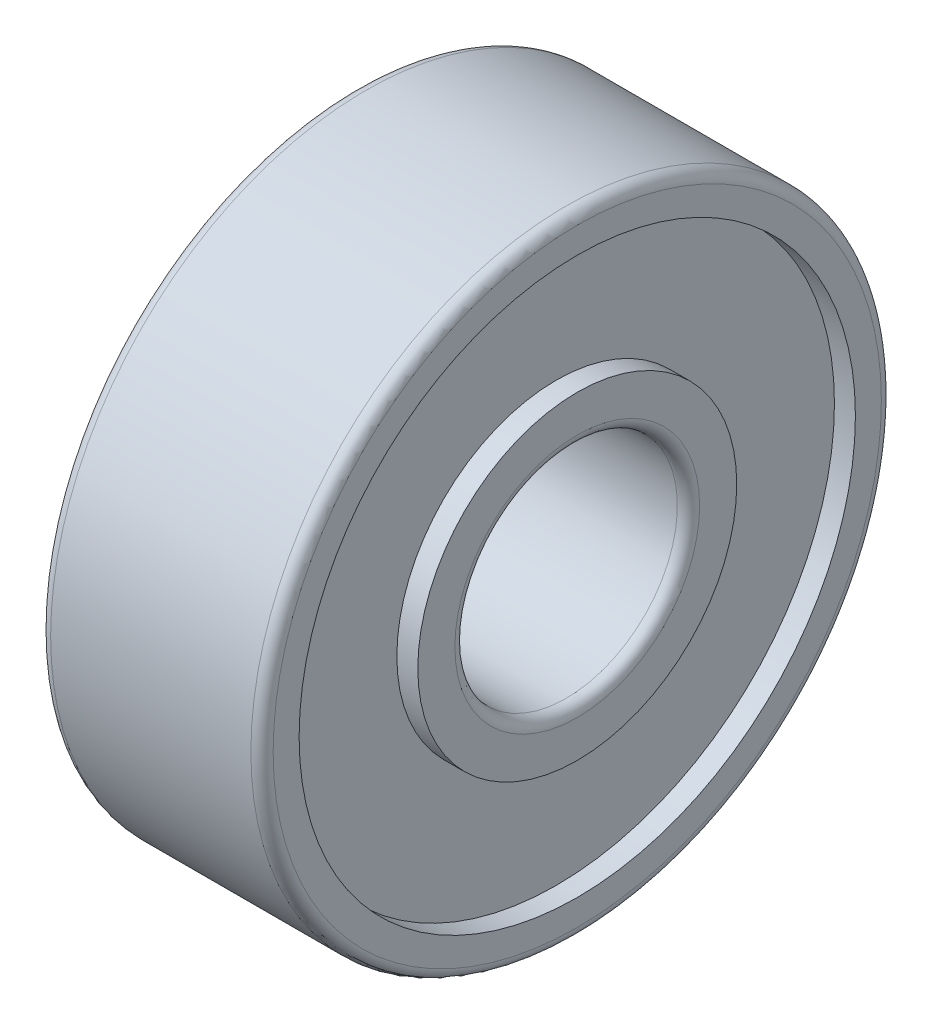
from build123d import *


with BuildPart() as part:
    # 草图1 → 旋转1 (revolve)
    with BuildSketch(Plane.XY):
        with BuildLine():
            Line((0, 8.2), (0, 7.5))
            Line((0, 7.5), (0.565, 7.5))
            Line((0.565, 7.5), (0.565, 4.3))
            Line((0.565, 4.3), (0, 4.3))
            Line((0, 4.3), (0, 3.3))
            ThreePointArc((0, 3.3), (0.087867966, 3.087867966), (0.3, 3))
            Line((0.3, 3), (5.7, 3))
            ThreePointArc((5.7, 3), (5.912132034, 3.087867966), (6, 3.3))
            Line((6, 3.3), (6, 4.3))
            Line((6, 4.3), (5.435, 4.3))
            Line((5.435, 4.3), (5.435, 7.5))
            Line((5.435, 7.5), (6, 7.5))
            Line((6, 7.5), (6, 8.2))
            ThreePointArc((6, 8.2), (5.912132034, 8.412132034), (5.7, 8.5))
            Line((5.7, 8.5), (0.3, 8.5))
            ThreePointArc((0.3, 8.5), (0.087867966, 8.412132034), (0, 8.2))
        make_face()
    revolve(axis=Axis((5.7, 0, 0), (-1, 0, 0)))


solid = part.part
